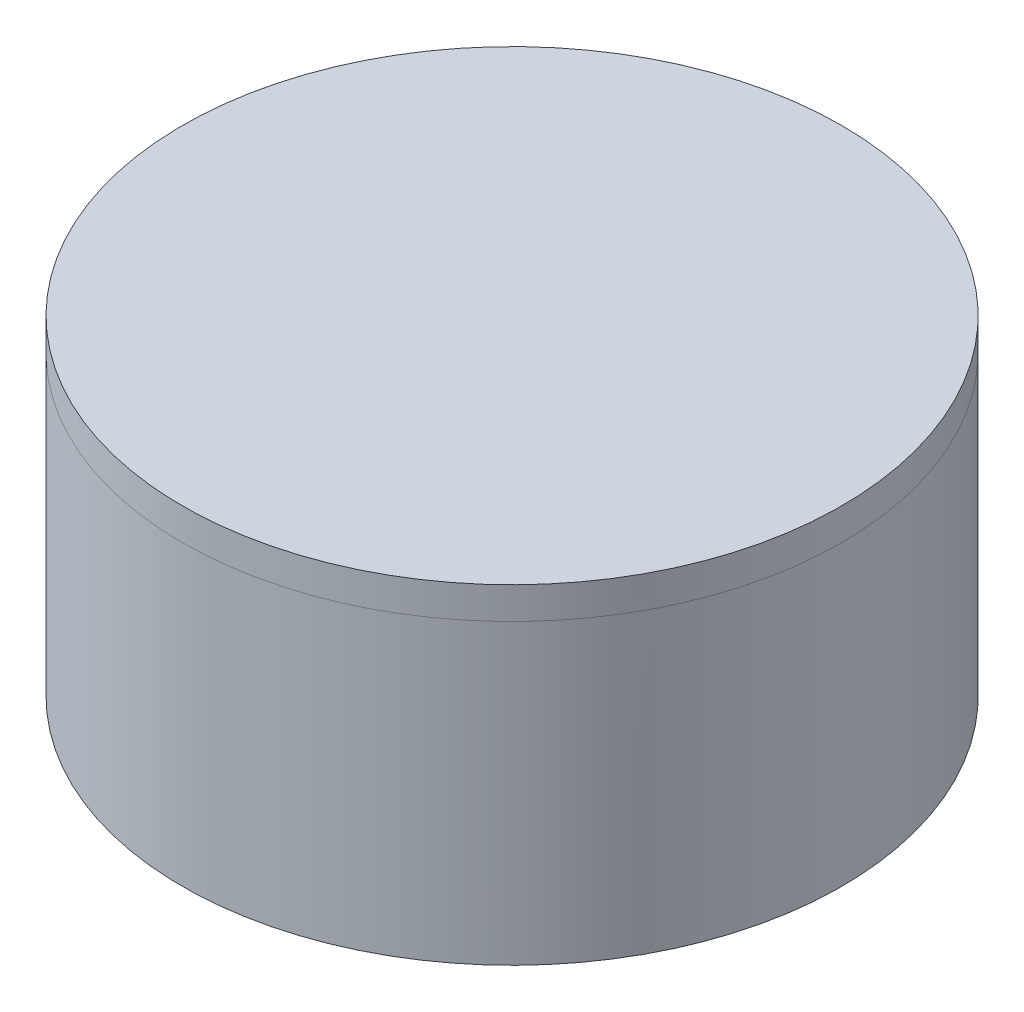
from build123d import *

# Parameters (mm, degrees)
SKETCH1_W       = 80
SKETCH1_H       = 80
CAVITY1_START   = -7.5
CAVITY1_2_DEPTH = 15


with BuildPart() as part:
    # Sketch1 → Revolve1 (revolve)
    with BuildSketch(Plane.XY, mode=Mode.PRIVATE) as revolve1_sk:
        with Locations((-40, -2.5)):
            Rectangle(SKETCH1_W, SKETCH1_H)
    revolve(revolve1_sk.sketch.rotate(Axis((0, -42.5, 0), (0, 1, 0)), 270), axis=Axis((0, -42.5, 0), (0, 1, 0)))

    # Cavity1: read off the stored shape, not the designer's step
    # Cavity1 outline → Cavity1 (revolve, cut)
    with BuildSketch(Plane.XY):
        with BuildLine():
            Line((22.192910746, 10.476369291), (51.094361394, -39.038300205))
            ThreePointArc((51.094361394, -39.038300205), (54.080040721, -40.499903904), (56.581029647, -38.310013312))
            Line((56.581029647, -38.310013312), (74.246530914, 26.936250812))
            Line((74.246530914, 26.936250812), (74.246530914, 29.664423233))
            Line((74.246530914, 29.664423233), (71.251310853, 29.771156937))
            Line((71.251310853, 29.771156937), (71.166259119, 27.038717428))
            Line((71.166259119, 27.038717428), (55.558571629, -30.607158845))
            ThreePointArc((55.558571629, -30.607158845), (53.057582703, -32.797049437), (50.071903376, -31.335445739))
            Line((50.071903376, -31.335445739), (24.783839845, 11.9886809))
            ThreePointArc((24.783839845, 11.9886809), (17.716997937, 19.559200307), (8.078409083, 23.347421995))
            Line((8.078409083, 23.347421995), (8.078409083, 29.771156937))
            Line((8.078409083, 29.771156937), (5.078409083, 29.771156937))
            Line((5.078409083, 29.771156937), (5.078409083, 20.60985703))
            ThreePointArc((5.078409083, 20.60985703), (14.950650083, 17.764007092), (22.192910746, 10.476369291))
        make_face()
    revolve(axis=Axis((0, 0, 0), (0, 1, 0)), mode=Mode.SUBTRACT)

    # Cavity1 2 outline → Cavity1 2 (add)
    with BuildSketch(Plane(origin=(0, 0, 0), x_dir=(0, 1, 0), z_dir=(0.9999948985251625, 0, -0.0031942015668954887)).offset(CAVITY1_START)):
        Polygon((7.567720421, -26.206445295), (-26.978000902, -46.370600081), (-26.473897032, -47.234243114), (-26.026928788, -48), (9, -48), (9, -28.660261568), (8.071824291, -27.070088328), align=None)
        Polygon((8.071824291, 27.070088328), (9, 28.660261568), (9, 48), (-26.026928788, 48), (-26.473897032, 47.234243114), (-26.978000902, 46.370600081), (7.567720421, 26.206445295), align=None)
    extrude(amount=CAVITY1_2_DEPTH)


with BuildPart() as body_2:
    # Split1: the piece on the far side of the plane
    add(part.part)
    split(bisect_by=Plane.ZX.offset(29.771156937), keep=Keep.BOTTOM)


with BuildPart() as part_1:
    add(part.part)

    # Split1
    split(bisect_by=Plane.ZX.offset(29.771156937), keep=Keep.TOP)


solid = Compound([body_2.part, part_1.part])
